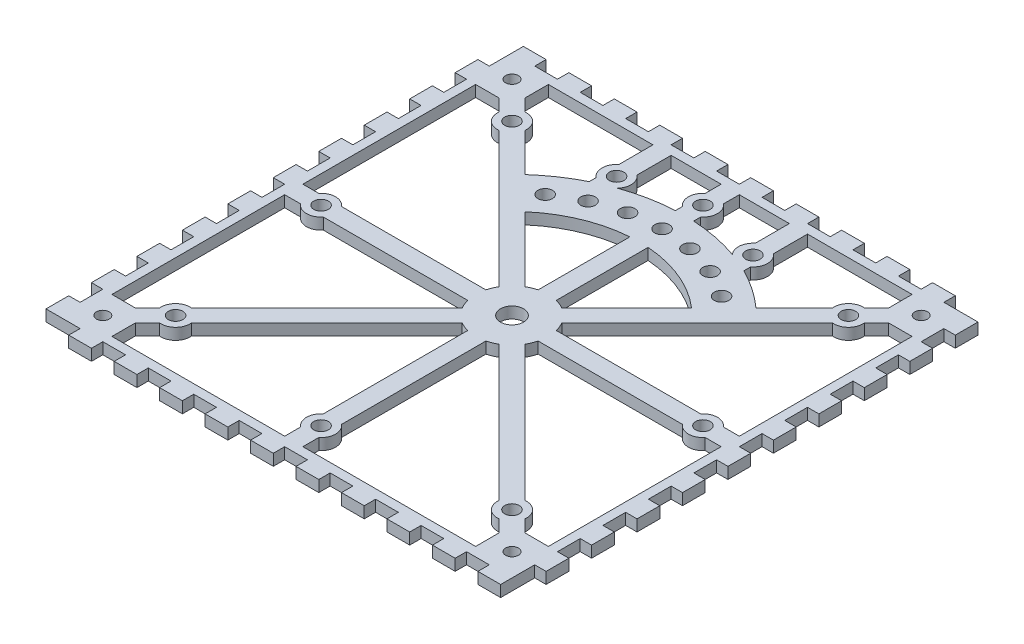
from build123d import *

# Parameters (mm, degrees)
SKETCH1_R           = 2.55
SKETCH1_R_2         = 1.6
SKETCH1_R_3         = 1.4
BOSS_EXTRUDE1_DEPTH = 2.5


with BuildPart() as part:
    # Sketch1 → Boss-Extrude1 (new body)
    with BuildSketch(Plane(origin=(0, 0, 0), x_dir=(1, 0, 0), z_dir=(0, 1, 0))):
        Polygon((-50, 50), (-50, 52.5), (-45, 52.5), (-45, 50), (-40, 50), (-40, 52.5), (-35, 52.5), (-35, 50), (-30, 50), (-30, 52.5), (-25, 52.5), (-25, 50), (-20, 50), (-20, 52.5), (-15, 52.5), (-15, 50), (-10, 50), (-10, 52.5), (-5, 52.5), (-5, 50), (0, 50), (0, 52.5), (5, 52.5), (5, 50), (10, 50), (10, 52.5), (15, 52.5), (15, 50), (20, 50), (20, 52.5), (25, 52.5), (25, 50), (30, 50), (30, 52.5), (35, 52.5), (35, 50), (40, 50), (40, 52.5), (45, 52.5), (45, 50), (50, 50), (52.5, 50), (52.5, 45), (50, 45), (50, 40), (52.5, 40), (52.5, 35), (50, 35), (50, 30), (52.5, 30), (52.5, 25), (50, 25), (50, 20), (52.5, 20), (52.5, 15), (50, 15), (50, 10), (52.5, 10), (52.5, 5), (50, 5), (50, 0), (52.5, 0), (52.5, -5), (50, -5), (50, -10), (52.5, -10), (52.5, -15), (50, -15), (50, -20), (52.5, -20), (52.5, -25), (50, -25), (50, -30), (52.5, -30), (52.5, -35), (50, -35), (50, -40), (52.5, -40), (52.5, -45), (50, -45), (50, -50), (50, -52.5), (45, -52.5), (45, -50), (40, -50), (40, -52.5), (35, -52.5), (35, -50), (30, -50), (30, -52.5), (25, -52.5), (25, -50), (20, -50), (20, -52.5), (15, -52.5), (15, -50), (10, -50), (10, -52.5), (5, -52.5), (5, -50), (0, -50), (0, -52.5), (-5, -52.5), (-5, -50), (-10, -50), (-10, -52.5), (-15, -52.5), (-15, -50), (-20, -50), (-20, -52.5), (-25, -52.5), (-25, -50), (-30, -50), (-30, -52.5), (-35, -52.5), (-35, -50), (-40, -50), (-40, -52.5), (-45, -52.5), (-45, -50), (-50, -50), (-52.5, -50), (-52.5, -45), (-50, -45), (-50, -40), (-52.5, -40), (-52.5, -35), (-50, -35), (-50, -30), (-52.5, -30), (-52.5, -25), (-50, -25), (-50, -20), (-52.5, -20), (-52.5, -15), (-50, -15), (-50, -10), (-52.5, -10), (-52.5, -5), (-50, -5), (-50, 0), (-52.5, 0), (-52.5, 5), (-50, 5), (-50, 10), (-52.5, 10), (-52.5, 15), (-50, 15), (-50, 20), (-52.5, 20), (-52.5, 25), (-50, 25), (-50, 30), (-52.5, 30), (-52.5, 35), (-50, 35), (-50, 40), (-52.5, 40), (-52.5, 45), (-50, 45), align=None)
        Circle(SKETCH1_R, mode=Mode.SUBTRACT)
        with Locations((37, -37)):
            Circle(SKETCH1_R_2, mode=Mode.SUBTRACT)
        with Locations((-37, -37)):
            Circle(SKETCH1_R_2, mode=Mode.SUBTRACT)
        with Locations((-37, 37)):
            Circle(SKETCH1_R_2, mode=Mode.SUBTRACT)
        with Locations((37, 37)):
            Circle(SKETCH1_R_2, mode=Mode.SUBTRACT)
        with Locations((0, 42)):
            Circle(SKETCH1_R_2, mode=Mode.SUBTRACT)
        with Locations((42, 0)):
            Circle(SKETCH1_R_2, mode=Mode.SUBTRACT)
        with Locations((-42, 0)):
            Circle(SKETCH1_R_2, mode=Mode.SUBTRACT)
        with Locations((0, -42)):
            Circle(SKETCH1_R_2, mode=Mode.SUBTRACT)
        with Locations((-45, 45)):
            Circle(SKETCH1_R_3, mode=Mode.SUBTRACT)
        with Locations((45, 45)):
            Circle(SKETCH1_R_3, mode=Mode.SUBTRACT)
        with Locations((-45, -45)):
            Circle(SKETCH1_R_3, mode=Mode.SUBTRACT)
        with Locations((45, -45)):
            Circle(SKETCH1_R_3, mode=Mode.SUBTRACT)
        with Locations((-15, 38)):
            Circle(SKETCH1_R_2, mode=Mode.SUBTRACT)
        with Locations((15, 38)):
            Circle(SKETCH1_R_2, mode=Mode.SUBTRACT)
        with Locations((0, 33)):
            Circle(SKETCH1_R_2, mode=Mode.SUBTRACT)
        with Locations((6.861085797, 32.278870824)):
            Circle(SKETCH1_R_2, mode=Mode.SUBTRACT)
        with Locations((13.422309222, 30.147000102)):
            Circle(SKETCH1_R_2, mode=Mode.SUBTRACT)
        with Locations((19.396913326, 26.697560814)):
            Circle(SKETCH1_R_2, mode=Mode.SUBTRACT)
        with Locations((-19.396913326, 26.697560814)):
            Circle(SKETCH1_R_2, mode=Mode.SUBTRACT)
        with Locations((-13.422309221, 30.147000102)):
            Circle(SKETCH1_R_2, mode=Mode.SUBTRACT)
        with Locations((-6.861085797, 32.278870824)):
            Circle(SKETCH1_R_2, mode=Mode.SUBTRACT)
        with BuildLine():
            Line((-40, 48), (-17, 48))
            Line((-17, 48), (-17, 40.497999199))
            ThreePointArc((-17, 40.497999199), (-18.2, 38), (-17, 35.502000801))
            Line((-17, 35.502000801), (-17, 33.985290936))
            ThreePointArc((-17, 33.985290936), (-21.402484999, 31.399580186), (-25.418602168, 28.247029292))
            Line((-25.418602168, 28.247029292), (-33.819434264, 36.647861389))
            ThreePointArc((-33.819434264, 36.647861389), (-34.7372583, 39.2627417), (-37.352138611, 40.180565736))
            Line((-37.352138611, 40.180565736), (-40, 42.828427125))
            Line((-40, 42.828427125), (-40, 48))
        make_face(mode=Mode.SUBTRACT)
        with BuildLine():
            Line((-48, 40), (-48, 2))
            Line((-48, 2), (-44.497999199, 2))
            ThreePointArc((-44.497999199, 2), (-42, 3.2), (-39.502000801, 2))
            Line((-39.502000801, 2), (-7.745966692, 2))
            ThreePointArc((-7.745966692, 2), (-7.39103626, 3.061467459), (-6.891439137, 4.063012013))
            Line((-6.891439137, 4.063012013), (-36.647861389, 33.819434264))
            ThreePointArc((-36.647861389, 33.819434264), (-39.2627417, 34.7372583), (-40.180565736, 37.352138611))
            Line((-40.180565736, 37.352138611), (-42.828427125, 40))
            Line((-42.828427125, 40), (-48, 40))
        make_face(mode=Mode.SUBTRACT)
        with BuildLine():
            Line((-40, -48), (-2, -48))
            Line((-2, -48), (-2, -44.497999199))
            ThreePointArc((-2, -44.497999199), (-3.2, -42), (-2, -39.502000801))
            Line((-2, -39.502000801), (-2, -7.745966692))
            ThreePointArc((-2, -7.745966692), (-3.061467459, -7.39103626), (-4.063012013, -6.891439137))
            Line((-4.063012013, -6.891439137), (-33.819434264, -36.647861389))
            ThreePointArc((-33.819434264, -36.647861389), (-34.7372583, -39.2627417), (-37.352138611, -40.180565736))
            Line((-37.352138611, -40.180565736), (-40, -42.828427125))
            Line((-40, -42.828427125), (-40, -48))
        make_face(mode=Mode.SUBTRACT)
        with BuildLine():
            Line((48, 40), (48, 2))
            Line((48, 2), (44.497999199, 2))
            ThreePointArc((44.497999199, 2), (42, 3.2), (39.502000801, 2))
            Line((39.502000801, 2), (7.745966692, 2))
            ThreePointArc((7.745966692, 2), (7.39103626, 3.061467459), (6.891439137, 4.063012013))
            Line((6.891439137, 4.063012013), (36.647861389, 33.819434264))
            ThreePointArc((36.647861389, 33.819434264), (39.2627417, 34.7372583), (40.180565736, 37.352138611))
            Line((40.180565736, 37.352138611), (42.828427125, 40))
            Line((42.828427125, 40), (48, 40))
        make_face(mode=Mode.SUBTRACT)
        with BuildLine():
            Line((48, -2), (48, -40))
            Line((48, -40), (42.828427125, -40))
            Line((42.828427125, -40), (40.180565736, -37.352138611))
            ThreePointArc((40.180565736, -37.352138611), (39.2627417, -34.7372583), (36.647861389, -33.819434264))
            Line((36.647861389, -33.819434264), (6.891439137, -4.063012013))
            ThreePointArc((6.891439137, -4.063012013), (7.39103626, -3.061467459), (7.745966692, -2))
            Line((7.745966692, -2), (39.502000801, -2))
            ThreePointArc((39.502000801, -2), (42, -3.2), (44.497999199, -2))
            Line((44.497999199, -2), (48, -2))
        make_face(mode=Mode.SUBTRACT)
        with BuildLine():
            Line((40, -42.828427125), (37.352138611, -40.180565736))
            ThreePointArc((37.352138611, -40.180565736), (34.7372583, -39.2627417), (33.819434264, -36.647861389))
            Line((33.819434264, -36.647861389), (4.063012013, -6.891439137))
            ThreePointArc((4.063012013, -6.891439137), (3.061467459, -7.39103626), (2, -7.745966692))
            Line((2, -7.745966692), (2, -39.502000801))
            ThreePointArc((2, -39.502000801), (3.2, -42), (2, -44.497999199))
            Line((2, -44.497999199), (2, -48))
            Line((2, -48), (40, -48))
            Line((40, -48), (40, -42.828427125))
        make_face(mode=Mode.SUBTRACT)
        with BuildLine():
            Line((-48, -2), (-44.497999199, -2))
            ThreePointArc((-44.497999199, -2), (-42, -3.2), (-39.502000801, -2))
            Line((-39.502000801, -2), (-7.745966692, -2))
            ThreePointArc((-7.745966692, -2), (-7.39103626, -3.061467459), (-6.891439137, -4.063012013))
            Line((-6.891439137, -4.063012013), (-36.647861389, -33.819434264))
            ThreePointArc((-36.647861389, -33.819434264), (-39.2627417, -34.7372583), (-40.180565736, -37.352138611))
            Line((-40.180565736, -37.352138611), (-42.828427125, -40))
            Line((-42.828427125, -40), (-48, -40))
            Line((-48, -40), (-48, -2))
        make_face(mode=Mode.SUBTRACT)
        with BuildLine():
            Line((2, 48), (2, 44.497999199))
            ThreePointArc((2, 44.497999199), (3.2, 42), (2, 39.502000801))
            Line((2, 39.502000801), (2, 37.947331922))
            ThreePointArc((2, 37.947331922), (7.397643577, 37.272977739), (12.643700473, 35.834855076))
            ThreePointArc((12.643700473, 35.834855076), (11.809300285, 38.243793623), (13, 40.497999199))
            Line((13, 40.497999199), (13, 48))
            Line((13, 48), (2, 48))
        make_face(mode=Mode.SUBTRACT)
        with BuildLine():
            Line((-2, 39.502000801), (-2, 37.947331922))
            ThreePointArc((-2, 37.947331922), (-7.397643577, 37.272977739), (-12.643700473, 35.834855076))
            ThreePointArc((-12.643700473, 35.834855076), (-11.809300285, 38.243793623), (-13, 40.497999199))
            Line((-13, 40.497999199), (-13, 48))
            Line((-13, 48), (-2, 48))
            Line((-2, 48), (-2, 44.497999199))
            ThreePointArc((-2, 44.497999199), (-3.2, 42), (-2, 39.502000801))
        make_face(mode=Mode.SUBTRACT)
        with BuildLine():
            Line((33.819434264, 36.647861389), (25.418602168, 28.247029292))
            ThreePointArc((25.418602168, 28.247029292), (21.402484999, 31.399580186), (17, 33.985290936))
            Line((17, 33.985290936), (17, 35.502000801))
            ThreePointArc((17, 35.502000801), (18.2, 38), (17, 40.497999199))
            Line((17, 40.497999199), (17, 48))
            Line((17, 48), (40, 48))
            Line((40, 48), (40, 42.828427125))
            Line((40, 42.828427125), (37.352138611, 40.180565736))
            ThreePointArc((37.352138611, 40.180565736), (34.7372583, 39.2627417), (33.819434264, 36.647861389))
        make_face(mode=Mode.SUBTRACT)
        with BuildLine():
            Line((-18.334204096, 21.162631221), (-4.063012013, 6.891439137))
            ThreePointArc((-4.063012013, 6.891439137), (-3.061467459, 7.39103626), (-2, 7.745966692))
            Line((-2, 7.745966692), (-2, 27.928480088))
            ThreePointArc((-2, 27.928480088), (-10.715136106, 25.86862691), (-18.334204096, 21.162631221))
        make_face(mode=Mode.SUBTRACT)
        with BuildLine():
            Line((18.334204096, 21.16263122), (4.063012013, 6.891439137))
            ThreePointArc((4.063012013, 6.891439137), (3.061467459, 7.39103626), (2, 7.745966692))
            Line((2, 7.745966692), (2, 27.928480088))
            ThreePointArc((2, 27.928480088), (10.715136106, 25.86862691), (18.334204096, 21.16263122))
        make_face(mode=Mode.SUBTRACT)
    extrude(amount=BOSS_EXTRUDE1_DEPTH)


solid = part.part
